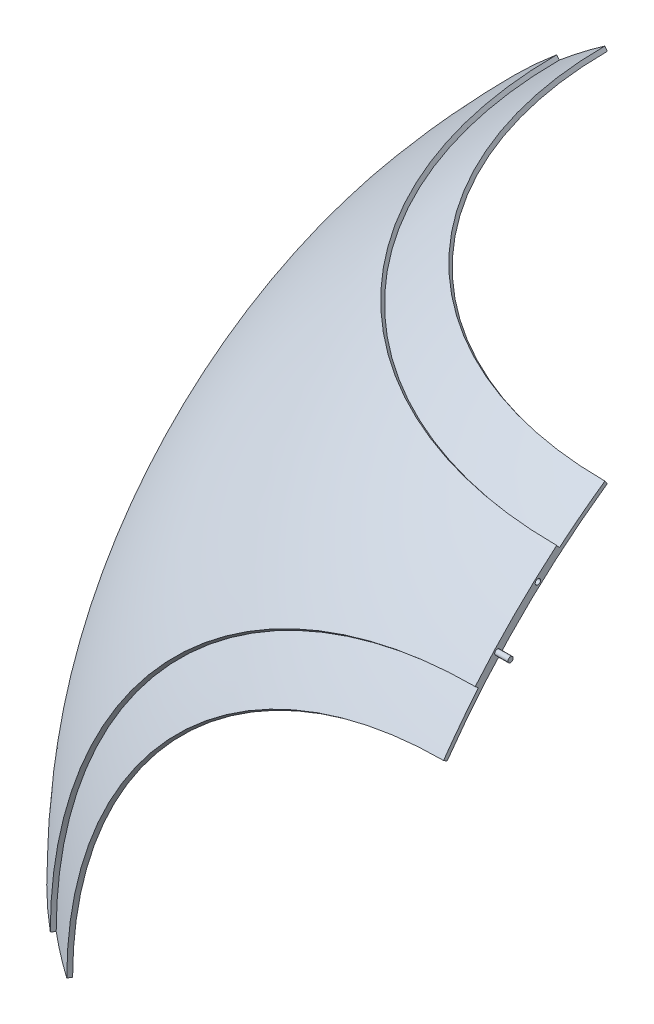
from build123d import *

# Parameters (mm, degrees)
REVOLVE1_ANGLE      = 90
SKETCH5_R           = 1
BOSS_EXTRUDE2_DEPTH = 5
SKETCH5_3_R         = 1
CUT_EXTRUDE1_DEPTH  = 5
SKETCH7_R           = 1
BOSS_EXTRUDE3_DEPTH = 5
SKETCH7_3_R         = 1
CUT_EXTRUDE2_DEPTH  = 5
SKETCH9_R           = 1
BOSS_EXTRUDE4_DEPTH = 5
SKETCH9_3_R         = 1
CUT_EXTRUDE3_DEPTH  = 5


with BuildPart() as part:
    # Sketch1 → Revolve1 (revolve)
    with BuildSketch(Plane.XY):
        with BuildLine():
            Line((-250, 0), (-246.825, 0))
            ThreePointArc((-246.825, 0), (-218.936448899, 113.971101462), (-141.573003902, 202.187203332))
            Line((-141.573003902, 202.187203332), (-142.483556495, 203.487607202))
            ThreePointArc((-142.483556495, 203.487607202), (-151.223948484, 197.078886645), (-159.676477091, 190.295015226))
            Line((-159.676477091, 190.295015226), (-160.696902422, 191.51111078))
            ThreePointArc((-160.696902422, 191.51111078), (-226.576946759, 105.654565435), (-250, 0))
        make_face()
    revolve(axis=Axis((0, 0, 0), (0, 1, 0)), revolution_arc=REVOLVE1_ANGLE)

    # Sketch3 → Cut-Revolve1 (revolve, cut)
    with BuildSketch(Plane(origin=(0, 0, 0), x_dir=(0, 0, -1), z_dir=(1, 0, 0))):
        with BuildLine():
            Line((-246.825, 0), (-250, 0))
            ThreePointArc((-250, 0), (-234.923155196, 85.505035831), (-191.51111078, 160.696902422))
            Line((-191.51111078, 160.696902422), (-190.295015226, 159.676477091))
            ThreePointArc((-190.295015226, 159.676477091), (-197.078886645, 151.223948484), (-203.487607202, 142.483556495))
            Line((-203.487607202, 142.483556495), (-202.187203332, 141.573003902))
            ThreePointArc((-202.187203332, 141.573003902), (-235.401186368, 74.221708963), (-246.825, 0))
        make_face()
    revolve(axis=Axis((0, 0, 246.825), (0, 0, 1)), mode=Mode.SUBTRACT)

    # Sketch4 → Cut-Revolve2 (revolve, cut)
    with BuildSketch(Plane(origin=(0, 0, 0), x_dir=(-1, 0, 0), z_dir=(0, 0, -1))):
        with BuildLine():
            Line((246.825, 0), (250, 0))
            ThreePointArc((250, 0), (234.923155196, 85.505035831), (191.51111078, 160.696902422))
            Line((191.51111078, 160.696902422), (190.295015226, 159.676477091))
            ThreePointArc((190.295015226, 159.676477091), (197.078886645, 151.223948484), (203.487607202, 142.483556495))
            Line((203.487607202, 142.483556495), (202.187203332, 141.573003902))
            ThreePointArc((202.187203332, 141.573003902), (235.401186368, 74.221708963), (246.825, 0))
        make_face()
    revolve(axis=Axis((-246.825, 0, 0), (-1, 0, 0)), mode=Mode.SUBTRACT)

    # Sketch5 → Boss-Extrude2 (add)
    with BuildSketch(Plane(origin=(0, 0, 0), x_dir=(-1, 0, 0), z_dir=(0, 0, -1))):
        with Locations((167.825052449, 183.14890643)):
            Circle(SKETCH5_R)
    extrude(amount=BOSS_EXTRUDE2_DEPTH)

    # Sketch5<3> → Cut-Extrude1 (cut)
    with BuildSketch(Plane(origin=(0, 0, 0), x_dir=(-1, 0, 0), z_dir=(0, 0, -1))):
        with Locations((183.14890643, 167.825052449)):
            Circle(SKETCH5_3_R)
    extrude(amount=-CUT_EXTRUDE1_DEPTH, mode=Mode.SUBTRACT)

    # Sketch7 → Boss-Extrude3 (add)
    with BuildSketch(Plane(origin=(0, 0, 0), x_dir=(0, 0, -1), z_dir=(1, 0, 0))):
        with Locations((-183.14890643, 167.825052449)):
            Circle(SKETCH7_R)
    extrude(amount=BOSS_EXTRUDE3_DEPTH)

    # Sketch7<3> → Cut-Extrude2 (cut)
    with BuildSketch(Plane(origin=(0, 0, 0), x_dir=(0, 0, -1), z_dir=(1, 0, 0))):
        with Locations((-167.825052449, 183.14890643)):
            Circle(SKETCH7_3_R)
    extrude(amount=-CUT_EXTRUDE2_DEPTH, mode=Mode.SUBTRACT)

    # Sketch9 → Boss-Extrude4 (add)
    with BuildSketch(Plane.XZ):
        with Locations((-183.14890643, 167.825052449)):
            Circle(SKETCH9_R)
    extrude(amount=BOSS_EXTRUDE4_DEPTH)

    # Sketch9<3> → Cut-Extrude3 (cut)
    with BuildSketch(Plane.XZ):
        with Locations((-167.825052449, 183.14890643)):
            Circle(SKETCH9_3_R)
    extrude(amount=-CUT_EXTRUDE3_DEPTH, mode=Mode.SUBTRACT)


solid = part.part
